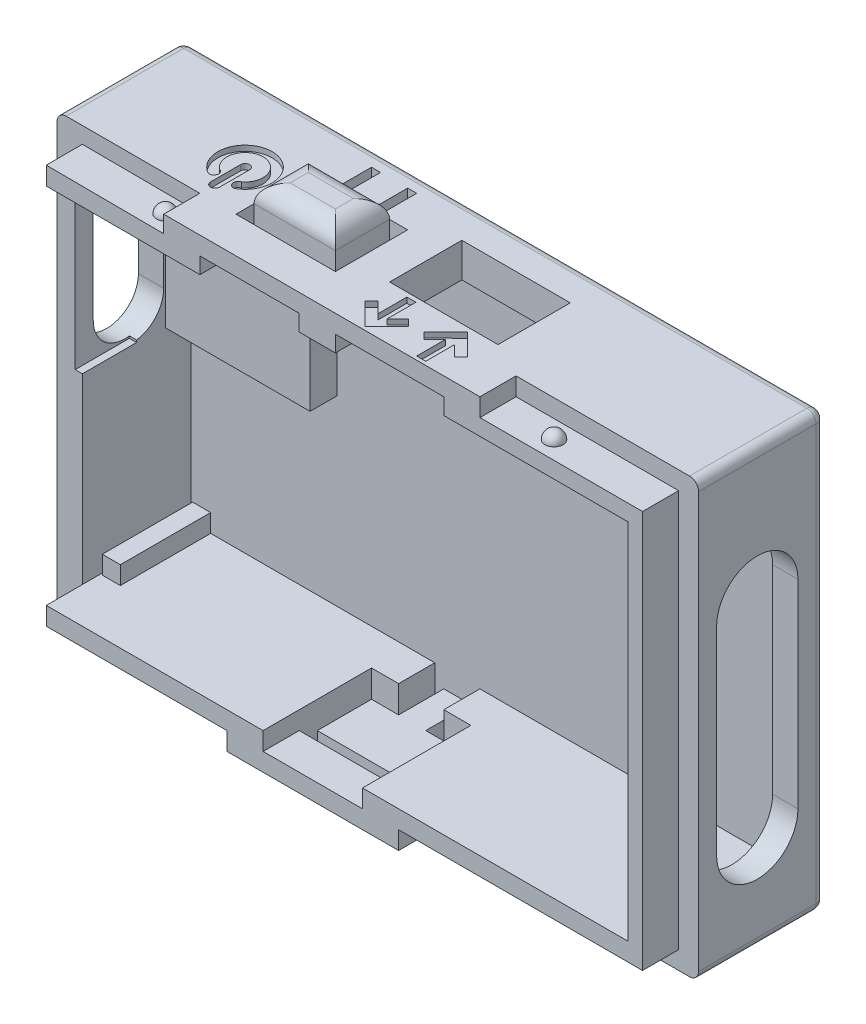
from build123d import *

# Parameters (mm, degrees)
SKETCH_1_W           = 35.5
SKETCH_1_H           = 24
EXTRUDE_1_DEPTH      = 7
SKETCH_2_W           = 33.2
SKETCH_2_H           = 22.1
CUT_EXTRUDE_1_DEPTH  = 6
CUT_EXTRUDE_2_DEPTH  = 2
EXTRUDE_2_DEPTH      = 6
SKETCH_7_W           = 5
SKETCH_7_H           = 2
EXTRUDE_3_DEPTH      = 5
CUT_EXTRUDE_4_DEPTH  = 2
SKETCH_12_W          = 5.5
SKETCH_12_H          = 2
CUT_EXTRUDE_6_DEPTH  = 6
SKETCH_19_W          = 8
SKETCH_19_H          = 10
USB_DEPTH            = 1.5
SKETCH_25_W          = 0.5
SKETCH_25_H          = 18.1
CUT_EXTRUDE_12_DEPTH = 6
SKETCH_28_W          = 5.5
SKETCH_28_H          = 1.9
CUT_EXTRUDE_13_DEPTH = 6
SKETCH_29_W          = 6
SKETCH_29_H          = 2
CUT_EXTRUDE_14_DEPTH = 5
SKETCH_34_W          = 1
SKETCH_34_H          = 1
EXTRUDE_10_DEPTH     = 5
SKETCH_35_W          = 0.5
SKETCH_35_H          = 10
CUT_EXTRUDE_15_DEPTH = 3
SKETCH_37_W          = 4.5
SKETCH_37_H          = 2
EXTRUDE_12_DEPTH     = 5.5
SKETCH_38_W          = 1.5
SKETCH_38_H          = 2.5
CUT_EXTRUDE_16_DEPTH = 2
SKETCH_39_W          = 4.5
SKETCH_39_H          = 1
CUT_EXTRUDE_17_DEPTH = 5.5
SKETCH_40_W          = 4.5
SKETCH_40_H          = 3
EXTRUDE_13_DEPTH     = 1.5
FILLET_2_R           = 1
SKETCH_41_W          = 4.5
SKETCH_41_H          = 2
EXTRUDE_14_DEPTH     = 5.5
SKETCH_42_W          = 1.5
SKETCH_42_H          = 2.5
CUT_EXTRUDE_18_DEPTH = 2
SKETCH_43_W          = 4.5
SKETCH_43_H          = 1
CUT_EXTRUDE_19_DEPTH = 5.5
SKETCH_44_W          = 4.5
SKETCH_44_H          = 3
EXTRUDE_15_DEPTH     = 1.5
FILLET_3_R           = 1
EXTRUDE_16_DEPTH     = 2
SKETCH_50_W          = 5.5
SKETCH_50_H          = 2
CUT_EXTRUDE_20_DEPTH = 2
SKETCH_51_W          = 5.5
SKETCH_51_H          = 2
CUT_EXTRUDE_21_DEPTH = 2
SKETCH_54_W          = 2
SKETCH_54_H          = 0.95
EXTRUDE_19_DEPTH     = 2
SKETCH_55_W          = 2
SKETCH_55_H          = 1
EXTRUDE_20_DEPTH     = 15.5
SKETCH_56_W          = 2
SKETCH_56_H          = 1
EXTRUDE_21_DEPTH     = 2
SKETCH_57_W          = 2
SKETCH_57_H          = 1
EXTRUDE_22_DEPTH     = 7.5
SKETCH_58_W          = 1.5
SKETCH_58_H          = 1.9
SKETCH_58_H_2        = 2
EXTRUDE_24_DEPTH     = 2
SKETCH_59_W          = 6
SKETCH_59_H          = 1
EXTRUDE_25_DEPTH     = 1
CUT_EXTRUDE_22_DEPTH = 0.3
CUT_EXTRUDE_23_DEPTH = 0.3
FILLET_4_R           = 0.5


with BuildPart() as part:
    # 草图1 → 凸台-拉伸1 (new body)
    with BuildSketch(Plane.XY):
        Rectangle(SKETCH_1_W, SKETCH_1_H)
    extrude(amount=EXTRUDE_1_DEPTH)

    # 草图2 → 切除-拉伸1 (cut)
    with BuildSketch(Plane.XY.offset(7)):
        with Locations((0.25, 0.05)):
            Rectangle(SKETCH_2_W, SKETCH_2_H)
    extrude(amount=-CUT_EXTRUDE_1_DEPTH, mode=Mode.SUBTRACT)

    # 草图3 → 切除-拉伸2 (cut)
    with BuildSketch(Plane.ZY.offset(17.75)):
        with BuildLine():
            Line((6, 7.45), (6, 1.95))
            ThreePointArc((6, 1.95), (4.25, 0.2), (2.5, 1.95))
            Line((2.5, 1.95), (2.5, 7.45))
            ThreePointArc((2.5, 7.45), (4.25, 9.2), (6, 7.45))
        make_face()
    extrude(amount=-CUT_EXTRUDE_2_DEPTH, mode=Mode.SUBTRACT)

    # 草图6 → 凸台-拉伸2 (add)
    with BuildSketch(Plane.XY.offset(1)):
        Polygon((-16.35, 10.1), (15.85, 10.1), (15.85, -10), (-16.35, -10), (-16.35, -11), (16.85, -11), (16.85, 11.1), (-16.35, 11.1), align=None)
    extrude(amount=EXTRUDE_2_DEPTH)

    # 草图7 → 凸台-拉伸3 (add)
    with BuildSketch(Plane.XY.offset(1)):
        with Locations((13.35, 9.1)):
            Rectangle(SKETCH_7_W, SKETCH_7_H)
    extrude(amount=EXTRUDE_3_DEPTH)

    # 草图10 → 切除-拉伸4 (cut)
    with BuildSketch(Plane.ZY.offset(-15.85)):
        with BuildLine():
            Line((1.5, -6.45), (1.5, 4.55))
            ThreePointArc((1.5, 4.55), (3.75, 6.8), (6, 4.55))
            Line((6, 4.55), (6, -6.45))
            ThreePointArc((6, -6.45), (3.75, -8.7), (1.5, -6.45))
        make_face()
    extrude(amount=-CUT_EXTRUDE_4_DEPTH, mode=Mode.SUBTRACT)

    # 草图12 → 切除-拉伸6 (cut)
    with BuildSketch(Plane.XY.offset(7)):
        with Locations((-1.6, -11)):
            Rectangle(SKETCH_12_W, SKETCH_12_H)
    extrude(amount=-CUT_EXTRUDE_6_DEPTH, mode=Mode.SUBTRACT)

    # 草图19 → USB支撑 (add)
    with BuildSketch(Plane.XY.offset(1)):
        with Locations((-12.25, 5.1)):
            Rectangle(SKETCH_19_W, SKETCH_19_H)
    extrude(amount=USB_DEPTH)

    # 草图25 → 切除-拉伸12 (cut)
    with BuildSketch(Plane.XY.offset(7)):
        with Locations((16.1, -0.95)):
            Rectangle(SKETCH_25_W, SKETCH_25_H)
    extrude(amount=-CUT_EXTRUDE_12_DEPTH, mode=Mode.SUBTRACT)

    # 草图28 → 切除-拉伸13 (cut)
    with BuildSketch(Plane.XY.offset(7)):
        with Locations((-5.1, 11.05)):
            Rectangle(SKETCH_28_W, SKETCH_28_H)
    extrude(amount=-CUT_EXTRUDE_13_DEPTH, mode=Mode.SUBTRACT)

    # 草图29 → 切除-拉伸14 (cut)
    with BuildSketch(Plane.XY.offset(7)):
        with Locations((2.65, 11)):
            Rectangle(SKETCH_29_W, SKETCH_29_H)
    extrude(amount=-CUT_EXTRUDE_14_DEPTH, mode=Mode.SUBTRACT)

    # 草图34 → 凸台-拉伸10 (add)
    with BuildSketch(Plane.XY.offset(1)):
        with Locations((-15.75, -9.5)):
            Rectangle(SKETCH_34_W, SKETCH_34_H)
    extrude(amount=EXTRUDE_10_DEPTH)

    # 草图35 → 切除-拉伸15 (cut)
    with BuildSketch(Plane.XY.offset(7)):
        with Locations((-16.5, 5.1)):
            Rectangle(SKETCH_35_W, SKETCH_35_H)
    extrude(amount=-CUT_EXTRUDE_15_DEPTH, mode=Mode.SUBTRACT)

    # 草图37 → 凸台-拉伸12 (add)
    with BuildSketch(Plane.XY.offset(1)):
        with Locations((-1.6, -11)):
            Rectangle(SKETCH_37_W, SKETCH_37_H)
    extrude(amount=EXTRUDE_12_DEPTH)

    # 草图38 → 切除-拉伸16 (cut)
    with BuildSketch(Plane.XZ.offset(12)):
        with Locations((-3.1, 2.25)):
            Rectangle(SKETCH_38_W, SKETCH_38_H)
        with Locations((-0.1, 2.25)):
            Rectangle(SKETCH_38_W, SKETCH_38_H)
    extrude(amount=-CUT_EXTRUDE_16_DEPTH, mode=Mode.SUBTRACT)

    # 草图39 → 切除-拉伸17 (cut)
    with BuildSketch(Plane.XY.offset(6.5)):
        with Locations((-1.6, -10.5)):
            Rectangle(SKETCH_39_W, SKETCH_39_H)
    extrude(amount=-CUT_EXTRUDE_17_DEPTH, mode=Mode.SUBTRACT)

    # 草图40 → 凸台-拉伸13 (add)
    with BuildSketch(Plane.XZ.offset(12)):
        with Locations((-1.6, 5)):
            Rectangle(SKETCH_40_W, SKETCH_40_H)
    extrude(amount=EXTRUDE_13_DEPTH)

    # 圆角2
    fillet_2_edges = [part.edges().sort_by_distance(p)[0] for p in [
        (-1.6, -13.5, 3.5),
        (0.65, -13.5, 5),
        (-1.6, -13.5, 6.5),
        (-3.85, -13.5, 5),
    ]]
    fillet(fillet_2_edges, radius=FILLET_2_R)

    # 草图41 → 凸台-拉伸14 (add)
    with BuildSketch(Plane.XY.offset(1)):
        with Locations((-5.1, 11)):
            Rectangle(SKETCH_41_W, SKETCH_41_H)
    extrude(amount=EXTRUDE_14_DEPTH)

    # 草图42 → 切除-拉伸18 (cut)
    with BuildSketch(Plane(origin=(0, 12, 0), x_dir=(1, 0, 0), z_dir=(0, 1, 0))):
        with Locations((-6.6, -2.25)):
            Rectangle(SKETCH_42_W, SKETCH_42_H)
        with Locations((-3.6, -2.25)):
            Rectangle(SKETCH_42_W, SKETCH_42_H)
    extrude(amount=-CUT_EXTRUDE_18_DEPTH, mode=Mode.SUBTRACT)

    # 草图43 → 切除-拉伸19 (cut)
    with BuildSketch(Plane.XY.offset(6.5)):
        with Locations((-5.1, 10.5)):
            Rectangle(SKETCH_43_W, SKETCH_43_H)
    extrude(amount=-CUT_EXTRUDE_19_DEPTH, mode=Mode.SUBTRACT)

    # 草图44 → 凸台-拉伸15 (add)
    with BuildSketch(Plane(origin=(0, 12, 0), x_dir=(1, 0, 0), z_dir=(0, 1, 0))):
        with Locations((-5.1, -5)):
            Rectangle(SKETCH_44_W, SKETCH_44_H)
    extrude(amount=EXTRUDE_15_DEPTH)

    # 圆角3
    fillet_3_edges = [part.edges().sort_by_distance(p)[0] for p in [
        (-2.85, 13.5, 5),
        (-5.1, 13.5, 3.5),
        (-7.35, 13.5, 5),
        (-5.1, 13.5, 6.5),
    ]]
    fillet(fillet_3_edges, radius=FILLET_3_R)

    # 草图45 → 凸台-拉伸16 (add)
    with BuildSketch(Plane.XY.offset(7)):
        Polygon((-7.85, 10.1), (-16.35, 10.1), (-16.35, 11.1), (-7.85, 11.05), (-2.25, 11.05), (-0.35, 11.05), (-0.35, 10.1), (-2.35, 10.1), align=None)
        Polygon((1.25, -11), (-16.35, -11), (-16.35, -10), (1.15, -10), (15.85, -10), (15.85, 10.1), (5.65, 10.1), (5.65, 11), (16.65, 11), (16.65, 10), (16.65, -11), align=None)
    extrude(amount=EXTRUDE_16_DEPTH)

    # 草图46 → 旋转1 (revolve)
    with BuildSketch(Plane.XZ.offset(11)):
        with BuildLine():
            Line((-11.25, 8), (-10.25, 8))
            ThreePointArc((-10.25, 8), (-10.75, 8.5), (-11.25, 8))
        make_face()
    revolve(axis=Axis((-11.25, -11, 8), (1, 0, 0)))

    # 草图47 → 旋转2 (revolve)
    with BuildSketch(Plane.XZ.offset(11)):
        with BuildLine():
            Line((11.25, 8), (10.25, 8))
            ThreePointArc((10.25, 8), (10.75, 8.5), (11.25, 8))
        make_face()
    revolve(axis=Axis((11.25, -11, 8), (-1, 0, 0)))

    # 草图48 → 旋转3 (revolve)
    with BuildSketch(Plane(origin=(0, 11.05, 0), x_dir=(1, 0, 0), z_dir=(0, 1, 0))):
        with BuildLine():
            Line((-11.25, -8), (-10.25, -8))
            ThreePointArc((-10.25, -8), (-10.75, -7.5), (-11.25, -8))
        make_face()
    revolve(axis=Axis((-11.25, 11.05, 8), (1, 0, 0)))

    # 草图49 → 旋转4 (revolve)
    with BuildSketch(Plane(origin=(0, 11, 0), x_dir=(1, 0, 0), z_dir=(0, 1, 0))):
        with BuildLine():
            Line((10.25, -8), (11.25, -8))
            ThreePointArc((11.25, -8), (10.75, -7.5), (10.25, -8))
        make_face()
    revolve(axis=Axis((10.25, 11, 8), (1, 0, 0)))

    # 草图50 → 切除-拉伸20 (cut)
    with BuildSketch(Plane.XZ.offset(-10.1)):
        with Locations((-5.1, 8)):
            Rectangle(SKETCH_50_W, SKETCH_50_H)
    extrude(amount=-CUT_EXTRUDE_20_DEPTH, mode=Mode.SUBTRACT)

    # 草图51 → 切除-拉伸21 (cut)
    with BuildSketch(Plane.XZ.offset(11)):
        with Locations((-1.6, 8)):
            Rectangle(SKETCH_51_W, SKETCH_51_H)
    extrude(amount=-CUT_EXTRUDE_21_DEPTH, mode=Mode.SUBTRACT)

    # 草图54 → 凸台-拉伸19 (add)
    with BuildSketch(Plane.XY.offset(7)):
        with Locations((-8.85, 11.525)):
            Rectangle(SKETCH_54_W, SKETCH_54_H)
    extrude(amount=EXTRUDE_19_DEPTH)

    # 草图55 → 凸台-拉伸20 (add)
    with BuildSketch(Plane(origin=(-7.85, 0, 0), x_dir=(0, 0, -1), z_dir=(1, 0, 0))):
        with Locations((-8, 11.5)):
            Rectangle(SKETCH_55_W, SKETCH_55_H)
    extrude(amount=EXTRUDE_20_DEPTH)

    # 草图56 → 凸台-拉伸21 (add)
    with BuildSketch(Plane.XY.offset(7)):
        with Locations((-5.35, -11.5)):
            Rectangle(SKETCH_56_W, SKETCH_56_H)
    extrude(amount=EXTRUDE_21_DEPTH)

    # 草图57 → 凸台-拉伸22 (add)
    with BuildSketch(Plane(origin=(-4.35, 0, 0), x_dir=(0, 0, -1), z_dir=(1, 0, 0))):
        with Locations((-8, -11.5)):
            Rectangle(SKETCH_57_W, SKETCH_57_H)
    extrude(amount=EXTRUDE_22_DEPTH)

    # 草图58 → 凸台-拉伸24 (add)
    with BuildSketch(Plane.XY.offset(1)):
        with Locations((-7.1, 11.05)):
            Rectangle(SKETCH_58_W, SKETCH_58_H)
        with Locations((-3.1, 11.05)):
            Rectangle(SKETCH_58_W, SKETCH_58_H)
        with Locations((-3.6, -11)):
            Rectangle(SKETCH_58_W, SKETCH_58_H_2)
        with Locations((0.4, -11)):
            Rectangle(SKETCH_58_W, SKETCH_58_H_2)
    extrude(amount=EXTRUDE_24_DEPTH)

    # 草图59 → 凸台-拉伸25 (add)
    with BuildSketch(Plane(origin=(0, 0, 7), x_dir=(-1, 0, 0), z_dir=(0, 0, -1))):
        with Locations((-2.65, 11.5)):
            Rectangle(SKETCH_59_W, SKETCH_59_H)
    extrude(amount=EXTRUDE_25_DEPTH)

    # 草图61 → 切除-拉伸22 (cut)
    with BuildSketch(Plane(origin=(0, 12, 0), x_dir=(1, 0, 0), z_dir=(0, 1, 0))):
        with BuildLine():
            Line((-9.6, -6.159611152), (-9.6, -4.5))
            ThreePointArc((-9.6, -4.5), (-9.85, -4.25), (-10.1, -4.5))
            Line((-10.1, -4.5), (-10.1, -6.159611152))
            ThreePointArc((-10.1, -6.159611152), (-9.85, -6.409611152), (-9.6, -6.159611152))
        make_face()
        with BuildLine():
            ThreePointArc((-9.101668523, -5.8), (-9.85, -3), (-10.598331477, -5.8))
            ThreePointArc((-10.598331477, -5.8), (-10.274165739, -5.624165739), (-10.45, -5.3))
            ThreePointArc((-10.45, -5.3), (-9.85, -3.5), (-9.25, -5.3))
            ThreePointArc((-9.25, -5.3), (-9.425834261, -5.624165739), (-9.101668523, -5.8))
        make_face()
    extrude(amount=-CUT_EXTRUDE_22_DEPTH, mode=Mode.SUBTRACT)

    # 草图60 → 切除-拉伸23 (cut)
    with BuildSketch(Plane(origin=(0, 12, 0), x_dir=(1, 0, 0), z_dir=(0, 1, 0))):
        Polygon((4.45, -8.8), (4.45, -7.2), (5.049338639, -7.8), (5.403086939, -7.446641626), (4.200665644, -6.242893478), (2.995979535, -7.4462517), (3.349337909, -7.8), (3.95, -7.2), (3.95, -8.8), align=None)
        Polygon((1.35, -6.242893478), (0.85, -6.242893478), (0.85, -7.842893478), (0.250661361, -7.242893478), (-0.103086939, -7.596251853), (1.099334356, -8.8), (2.304020465, -7.596641778), (1.950662091, -7.242893478), (1.35, -7.842893478), align=None)
    extrude(amount=-CUT_EXTRUDE_23_DEPTH, mode=Mode.SUBTRACT)

    # 圆角4
    fillet_4_edges = [part.edges().sort_by_distance(p)[0] for p in [
        (0, -12, 0),
        (17.75, 0, 0),
        (0, 12, 0),
        (-17.75, 0, 0),
        (-17.75, 12, 3.5),
        (-17.75, -12, 3.5),
        (17.75, -12, 3.5),
        (17.75, 12, 3.5),
    ]]
    fillet(fillet_4_edges, radius=FILLET_4_R)


solid = part.part
